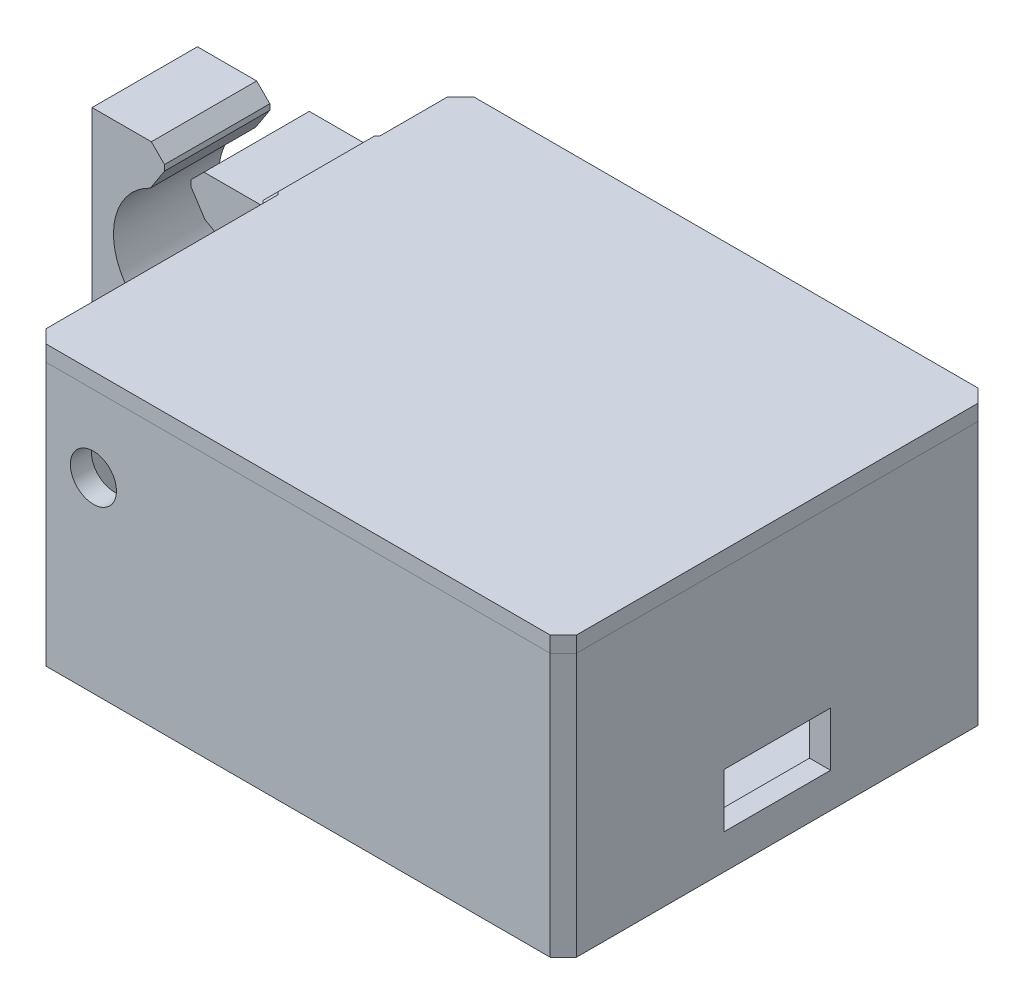
from build123d import *

# Parameters (mm, degrees)
SKETCH2_W                = 40.3
SKETCH2_H                = 32.5
BOSS_EXTRUDE1_DEPTH      = 1.2
SKETCH2_3_W              = 40.3
SKETCH2_3_H              = 32.5
SKETCH2_3_W_2            = 37.1
SKETCH2_3_H_2            = 29.3
BOSS_EXTRUDE2_DEPTH      = 20
CUT_EXTRUDE1_REACH       = 49.835
SKETCH3_W                = 8.1
SKETCH3_H                = 4.1
CHAMFER1_SIZE            = 1
SKETCH4_W                = 8
SKETCH4_H                = 15
BOSS_EXTRUDE3_DEPTH      = 15
CUT_EXTRUDE3_REACH       = 46.473
CHAMFER2_SIZE            = 1.292646163
CHAMFER2_SIZE_2          = 1
CHAMFER3_SIZE            = 1
SKETCH6_W                = 5
SKETCH6_H                = 2
CUT_EXTRUDE4_DEPTH       = 0.4
CHAMFER4_SIZE            = 0.4
CHAMFER4_OF_MIRROR1_SIZE = 0.4
SKETCH7_W                = 37.1
SKETCH7_H                = 29.3
BOSS_EXTRUDE4_DEPTH      = 1.2
CHAMFER5_SIZE            = 0.8
SKETCH8_W                = 36.6
SKETCH8_H                = 28.8
SKETCH8_W_2              = 35
SKETCH8_H_2              = 27.2
BOSS_EXTRUDE5_DEPTH      = 1.2
SKETCH10_W               = 5
SKETCH10_H               = 1.2
BOSS_EXTRUDE6_DEPTH      = 3.5
BOSS_EXTRUDE7_DEPTH      = 5
CUT_EXTRUDE6_START       = -11.5
CUT_EXTRUDE6_DEPTH       = 5
CUT_EXTRUDE6_START_2     = 6.5
CUT_EXTRUDE6_2_DEPTH     = 5
CUT_EXTRUDE6_START_3     = 14.65
CUT_EXTRUDE6_3_OUTLINE_R = 1.75
CUT_EXTRUDE6_3_DEPTH     = 1.6


with BuildPart() as part:
    # Sketch2 → Boss-Extrude1 (new body)
    with BuildSketch(Plane(origin=(0, 0, 0), x_dir=(1, 0, 0), z_dir=(0, 1, 0))):
        Rectangle(SKETCH2_W, SKETCH2_H)
    extrude(amount=BOSS_EXTRUDE1_DEPTH)

    # Sketch2<3> → Boss-Extrude2 (add)
    with BuildSketch(Plane(origin=(0, 0, 0), x_dir=(1, 0, 0), z_dir=(0, 1, 0))):
        Rectangle(SKETCH2_3_W, SKETCH2_3_H)
        Rectangle(SKETCH2_3_W_2, SKETCH2_3_H_2, mode=Mode.SUBTRACT)
    extrude(amount=BOSS_EXTRUDE2_DEPTH)

    # Sketch3 → Cut-Extrude1 (cut, up to next)
    with BuildSketch(Plane(origin=(20.15, 0, 0), x_dir=(0, 0, -1), z_dir=(1, 0, 0)), mode=Mode.PRIVATE) as cut_extrude1_sk1:
        with Locations((0, 4.7)):
            Rectangle(SKETCH3_W, SKETCH3_H)
    cut_extrude1_tool1 = extrude(cut_extrude1_sk1.sketch, amount=-CUT_EXTRUDE1_REACH, mode=Mode.PRIVATE) & part.part
    add(cut_extrude1_tool1.solids().sort_by_distance((20.15, 4.7, 0))[0], mode=Mode.SUBTRACT)

    # Chamfer1
    chamfer1_edges = [part.edges().sort_by_distance(p)[0] for p in [
        (-20.15, 10, -16.25),
        (20.15, 10, -16.25),
        (20.15, 10, 16.25),
        (-20.15, 10, 16.25),
    ]]
    chamfer(chamfer1_edges, length=CHAMFER1_SIZE)

    # Sketch4 → Boss-Extrude3 (add)
    with BuildSketch(Plane.ZY.offset(20.15)):
        with Locations((-6.25220384, 12.5)):
            Rectangle(SKETCH4_W, SKETCH4_H)
    extrude(amount=BOSS_EXTRUDE3_DEPTH)

    # Sketch5 → Cut-Extrude3 (cut, up to next)
    with BuildSketch(Plane.XY.offset(-2.25220384), mode=Mode.PRIVATE) as cut_extrude3_sk1:
        with BuildLine():
            Line((-28.65, 17.271333671), (-28.65, 20))
            Line((-28.65, 20), (-26.65, 20))
            Line((-26.65, 20), (-26.65, 17.271333671))
            ThreePointArc((-26.65, 17.271333671), (-27.65, 7.625), (-28.65, 17.271333671))
        make_face()
    cut_extrude3_tool1 = extrude(cut_extrude3_sk1.sketch, amount=-CUT_EXTRUDE3_REACH, mode=Mode.PRIVATE) & part.part
    add(cut_extrude3_tool1.solids().sort_by_distance((-27.65, 12.91032, -2.252204))[0], mode=Mode.SUBTRACT)

    # Chamfer2
    # the kernel refuses this chamfer: 1.292646163, 1 mm, written as the material it takes off along each edge
    with BuildSketch(Plane(origin=(-28.65, 17.271333671, 1.088369735), x_dir=(0, 1, 0), z_dir=(0, 0, -1))) as chamfer2_piece_1:
        with BuildLine():
            Line((CHAMFER2_SIZE, 0), (-0.363341225, -1.082120936))
            ThreePointArc((-0.363341225, -1.082120936), (-0.156455935, -0.571155143), (0, 0))
            Line((0, 0), (CHAMFER2_SIZE, 0))
        make_face()
    extrude(amount=14.68114715, mode=Mode.SUBTRACT)
    with BuildSketch(Plane(origin=(-28.65, 20, 0.319479148), x_dir=(-1, 0, 0), z_dir=(0, 0, -1))) as chamfer2_piece_2:
        Polygon((CHAMFER2_SIZE_2, 0), (0, -CHAMFER2_SIZE_2), (0, 0), align=None)
    extrude(amount=13.143365976, mode=Mode.SUBTRACT)
    with BuildSketch(Plane(origin=(-26.65, 20, 0.319479148), x_dir=(1, 0, 0), z_dir=(0, 0, -1))) as chamfer2_piece_3:
        Polygon((CHAMFER2_SIZE_2, 0), (0, CHAMFER2_SIZE_2), (0, 0), align=None)
    extrude(amount=13.143365976, mode=Mode.SUBTRACT)
    with BuildSketch(Plane(origin=(-26.65, 17.271333671, 1.088369735), x_dir=(0, 1, 0), z_dir=(0, 0, -1))) as chamfer2_piece_4:
        with BuildLine():
            Line((CHAMFER2_SIZE, 0), (-0.363341225, 1.082120936))
            ThreePointArc((-0.363341225, 1.082120936), (-0.156455935, 0.571155143), (0, 0))
            Line((0, 0), (CHAMFER2_SIZE, 0))
        make_face()
    extrude(amount=14.68114715, mode=Mode.SUBTRACT)

    # Chamfer3
    chamfer3_edges = [part.edges().sort_by_distance(p)[0] for p in [
        (-20.15, 12.5, -10.25220384),
        (-20.15, 12.5, -2.25220384),
        (-35.15, 12.5, -10.25220384),
        (-35.15, 12.5, -2.25220384),
        (-35.15, 20, -6.25220384),
    ]]
    chamfer(chamfer3_edges, length=CHAMFER3_SIZE)

    # Sketch6 → Cut-Extrude4 (cut)
    with BuildSketch(Plane(origin=(0, 0, 14.65), x_dir=(-1, 0, 0), z_dir=(0, 0, -1))):
        with Locations((-9, 17.5)):
            Rectangle(SKETCH6_W, SKETCH6_H)
        with Locations((9, 17.5)):
            Rectangle(SKETCH6_W, SKETCH6_H)
    cut_extrude4 = extrude(amount=-CUT_EXTRUDE4_DEPTH, mode=Mode.SUBTRACT)

    # Chamfer4
    chamfer4_edges = [part.edges().sort_by_distance(p)[0] for p in [
        (9, 18.5, 15.05),
        (-9, 18.5, 15.05),
    ]]
    chamfer(chamfer4_edges, length=CHAMFER4_SIZE - 0.0001)  # a hair under: the kernel refuses the full size

    # Mirror1: Cut-Extrude4 across plane
    add(cut_extrude4.mirror(Plane.XY), mode=Mode.SUBTRACT)

    # Chamfer4 of Mirror1
    chamfer4_of_mirror1_edges = [part.edges().sort_by_distance(p)[0] for p in [
        (9, 18.5, -15.05),
        (-9, 18.5, -15.05),
    ]]
    chamfer(chamfer4_of_mirror1_edges, length=CHAMFER4_OF_MIRROR1_SIZE - 0.0001)  # a hair under: the kernel refuses the full size

    # Cut-Extrude6 3 outline → Cut-Extrude6 3 (cut)
    with BuildSketch(Plane.XY.offset(CUT_EXTRUDE6_START_3)):
        with Locations((-15.55, 14.2)):
            Circle(CUT_EXTRUDE6_3_OUTLINE_R)
    extrude(amount=CUT_EXTRUDE6_3_DEPTH, mode=Mode.SUBTRACT)


with BuildPart() as body_2:
    # Sketch7 → Boss-Extrude4 (new body)
    # profile 1 of 2: a face of its own
    with BuildSketch(Plane(origin=(0, 20, 0), x_dir=(1, 0, 0), z_dir=(0, 1, 0))):
        Polygon((-21.15, 10.25220384), (-21.15, 2.25220384), (-20.15, 1.25220384), (-20.15, -15.25), (-19.15, -16.25), (19.15, -16.25), (20.15, -15.25), (20.15, 15.25), (19.15, 16.25), (-19.15, 16.25), (-20.15, 15.25), (-20.15, 11.25220384), align=None)
        Rectangle(SKETCH7_W, SKETCH7_H, mode=Mode.SUBTRACT)
    # profile 2 of 2: a face of its own
    with BuildSketch(Plane(origin=(0, 20, 0), x_dir=(1, 0, 0), z_dir=(0, 1, 0))):
        Rectangle(SKETCH7_W, SKETCH7_H)
    extrude(amount=BOSS_EXTRUDE4_DEPTH)

    # Chamfer5
    chamfer5_edges = [body_2.edges().sort_by_distance(p)[0] for p in [
        (-21.15, 21.2, -6.25220384),
        (-20.65, 21.2, -1.75220384),
        (-20.65, 21.2, -10.75220384),
    ]]
    chamfer(chamfer5_edges, length=CHAMFER5_SIZE)

    # Sketch8 → Boss-Extrude5 (add)
    with BuildSketch(Plane.XZ.offset(-20)):
        Rectangle(SKETCH8_W, SKETCH8_H)
        Rectangle(SKETCH8_W_2, SKETCH8_H_2, mode=Mode.SUBTRACT)
    extrude(amount=BOSS_EXTRUDE5_DEPTH)

    # Sketch10 → Boss-Extrude6 (add)
    with BuildSketch(Plane.XZ.offset(-20)):
        with Locations((9, 13.8)):
            Rectangle(SKETCH10_W, SKETCH10_H)
    extrude(amount=BOSS_EXTRUDE6_DEPTH)

    # Sketch13 → Boss-Extrude7 (add)
    with BuildSketch(Plane.ZY.offset(-6.5)):
        Polygon((15, 18.079289322), (14.4, 18.679289322), (14.4, 16.5), (15, 17.1), align=None)
    extrude(amount=-BOSS_EXTRUDE7_DEPTH)

    # Cut-Extrude6: read off the stored shape, not the designer's step
    # Cut-Extrude6 outline → Cut-Extrude6 (add)
    with BuildSketch(Plane.YZ.offset(CUT_EXTRUDE6_START)):
        Polygon((20, 13.2), (20, 13.6), (18.8, 13.6), (18.8, 14.4), (18.679289322, 14.4), (18.079289322, 15), (17.1, 15), (16.5, 14.4), (16.5, 13.2), align=None)
        Polygon((20, -13.6), (20, -13.2), (16.5, -13.2), (16.5, -14.4), (17.1, -15), (18.079289322, -15), (18.679289322, -14.4), (18.8, -14.4), (18.8, -13.6), align=None)
    extrude(amount=CUT_EXTRUDE6_DEPTH)

    # Cut-Extrude6 2 outline → Cut-Extrude6 2 (add)
    with BuildSketch(Plane.YZ.offset(CUT_EXTRUDE6_START_2)):
        Polygon((20, -13.6), (20, -13.2), (16.5, -13.2), (16.5, -14.4), (17.1, -15), (18.079289322, -15), (18.679289322, -14.4), (18.8, -14.4), (18.8, -13.6), align=None)
    extrude(amount=CUT_EXTRUDE6_2_DEPTH)


solid = Compound([part.part, body_2.part])
